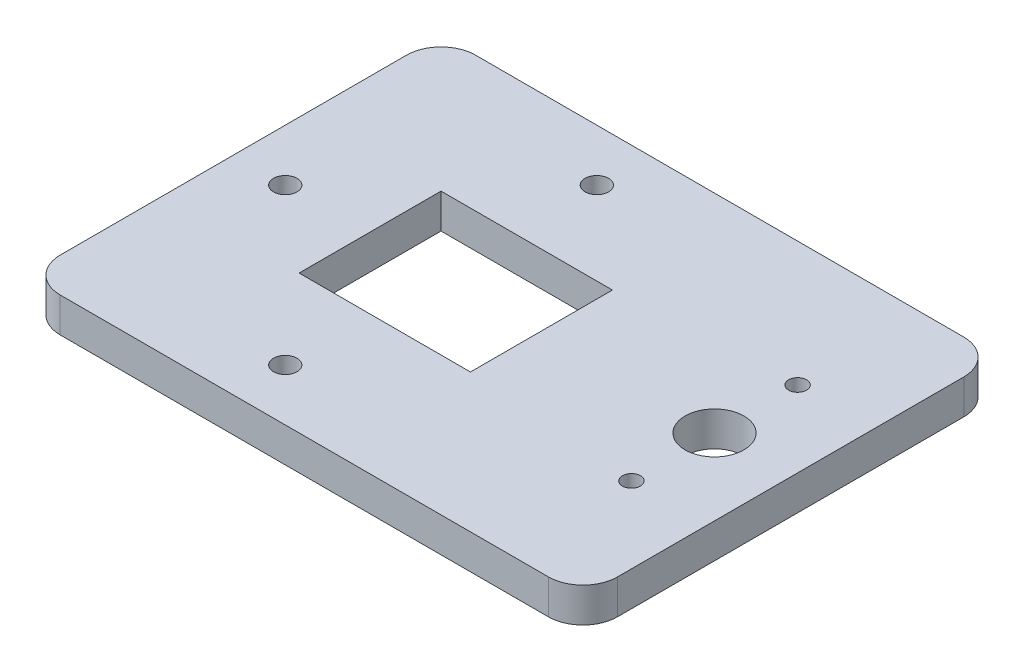
from build123d import *

# Parameters (mm, degrees)
SKETCH_1_W          = 161
SKETCH_1_H          = 120
EXTRUDE_1_DEPTH     = 10
FILLET_1_R          = 10
SKETCH_2_W          = 49.5
SKETCH_2_H          = 41
CUT_EXTRUDE_1_DEPTH = 10
SKETCH_3_R          = 8.5
CUT_EXTRUDE_2_DEPTH = 10
FILLET_2_R          = 10
SKETCH_5_R          = 3.4
CUT_EXTRUDE_4_DEPTH = 118.474465311
SKETCH_6_R          = 2.6
CUT_EXTRUDE_5_DEPTH = 10


with BuildPart() as part:
    # 草图1 → 凸台-拉伸1 (new body)
    with BuildSketch(Plane(origin=(0, 0, 0), x_dir=(1, 0, 0), z_dir=(0, 1, 0))):
        with Locations((-20, 0)):
            Rectangle(SKETCH_1_W, SKETCH_1_H)
    extrude(amount=EXTRUDE_1_DEPTH)

    # 圆角1
    fillet_1_edges = [part.edges().sort_by_distance(p)[0] for p in [
        (60.5, 5, -60),
        (60.5, 5, 60),
    ]]
    fillet(fillet_1_edges, radius=FILLET_1_R)

    # 草图2 → 切除-拉伸1 (cut)
    with BuildSketch(Plane(origin=(0, 10, 0), x_dir=(1, 0, 0), z_dir=(0, 1, 0))):
        with Locations((-36.75, 0.5)):
            Rectangle(SKETCH_2_W, SKETCH_2_H)
    extrude(amount=-CUT_EXTRUDE_1_DEPTH, mode=Mode.SUBTRACT)

    # 草图3 → 切除-拉伸2 (cut)
    with BuildSketch(Plane(origin=(0, 10, 0), x_dir=(1, 0, 0), z_dir=(0, 1, 0))):
        with Locations((38.5, 0)):
            Circle(SKETCH_3_R)
    extrude(amount=-CUT_EXTRUDE_2_DEPTH, mode=Mode.SUBTRACT)

    # 圆角2
    fillet_2_edges = [part.edges().sort_by_distance(p)[0] for p in [
        (-100.5, 5, -60),
        (-100.5, 5, 60),
    ]]
    fillet(fillet_2_edges, radius=FILLET_2_R)

    # 草图5 → 切除-拉伸4 (cut, through all)
    with BuildSketch(Plane.XZ):
        with Locations((-40.5, 45)):
            Circle(SKETCH_5_R)
        with Locations((-85.5, 0)):
            Circle(SKETCH_5_R)
        with Locations((-40.5, -45)):
            Circle(SKETCH_5_R)
    extrude(amount=-CUT_EXTRUDE_4_DEPTH, mode=Mode.SUBTRACT)

    # 草图6 → 切除-拉伸5 (cut)
    with BuildSketch(Plane(origin=(0, 10, 0), x_dir=(1, 0, 0), z_dir=(0, 1, 0))):
        with Locations((38.5, 24)):
            Circle(SKETCH_6_R)
        with Locations((38.5, -24)):
            Circle(SKETCH_6_R)
    extrude(amount=-CUT_EXTRUDE_5_DEPTH, mode=Mode.SUBTRACT)


solid = part.part
